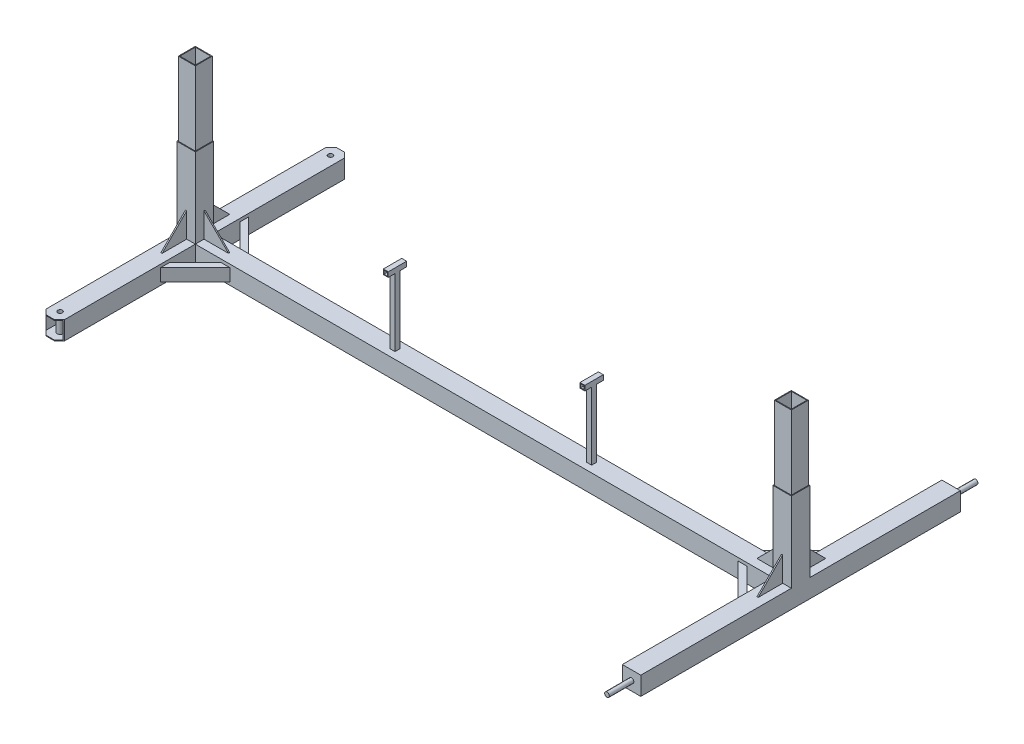
from build123d import *

# Parameters (mm, degrees)
SKETCH24_W           = 2500
SKETCH24_H           = 75
BOSS_EXTRUDE19_DEPTH = 75
SKETCH25_W           = 75
SKETCH25_H           = 75
BOSS_EXTRUDE21_DEPTH = 325
SKETCH27_W           = 69
SKETCH27_H           = 69
BOSS_EXTRUDE22_DEPTH = 300
SKETCH36_W           = 20
SKETCH36_H           = 20
BOSS_EXTRUDE29_DEPTH = 275
SKETCH37_W           = 20
SKETCH37_H           = 20
BOSS_EXTRUDE30_DEPTH = 37.5
SKETCH44_W           = 75
SKETCH44_H           = 75
BOSS_EXTRUDE35_DEPTH = 590
SKETCH46_W           = 75
SKETCH46_H           = 75
BOSS_EXTRUDE36_DEPTH = 650
BOSS_EXTRUDE37_DEPTH = 25
GUSSET1_THICKNESS    = 5
GUSSET2_THICKNESS    = 5
GUSSET3_THICKNESS    = 5
GUSSET4_THICKNESS    = 5
GUSSET5_THICKNESS    = 5
GUSSET6_THICKNESS    = 5
SHELL7_T             = -3
SKETCH54_R           = 12.5
BOSS_EXTRUDE38_DEPTH = 75
SKETCH55_R           = 9.5
CUT_EXTRUDE1_DEPTH   = 1542.30626418
CHAMFER1_SIZE        = 20
BOSS_EXTRUDE39_DEPTH = 6
SKETCH57_R           = 9.5
BOSS_EXTRUDE40_DEPTH = 30
SKETCH59_W           = 75
SKETCH59_H           = 75
BOSS_EXTRUDE41_DEPTH = 8
SKETCH60_R           = 9.5
BOSS_EXTRUDE42_DEPTH = 100


with BuildPart() as part:
    # Sketch24 → Boss-Extrude19 (new body)
    with BuildSketch(Plane(origin=(0, 0, 0), x_dir=(1, 0, 0), z_dir=(0, 1, 0))):
        Rectangle(SKETCH24_W, SKETCH24_H)
    extrude(amount=BOSS_EXTRUDE19_DEPTH)

    # Sketch25 → Boss-Extrude21 (add)
    with BuildSketch(Plane(origin=(0, 75, 0), x_dir=(1, 0, 0), z_dir=(0, 1, 0))):
        with Locations((-1212.5, 0)):
            Rectangle(SKETCH25_W, SKETCH25_H)
        with Locations((1212.5, 0)):
            Rectangle(SKETCH25_W, SKETCH25_H)
    extrude(amount=BOSS_EXTRUDE21_DEPTH)

    # Sketch27 → Boss-Extrude22 (add)
    with BuildSketch(Plane(origin=(0, 400, 0), x_dir=(1, 0, 0), z_dir=(0, 1, 0))):
        with Locations((-1212.5, 0)):
            Rectangle(SKETCH27_W, SKETCH27_H)
        with Locations((1212.5, 0)):
            Rectangle(SKETCH27_W, SKETCH27_H)
    extrude(amount=BOSS_EXTRUDE22_DEPTH)

    # Sketch36 → Boss-Extrude29 (add)
    with BuildSketch(Plane(origin=(0, 75, 0), x_dir=(1, 0, 0), z_dir=(0, 1, 0))):
        with Locations((-400, 0)):
            Rectangle(SKETCH36_W, SKETCH36_H)
    boss_extrude29 = extrude(amount=BOSS_EXTRUDE29_DEPTH)

    # Sketch37 → Boss-Extrude30 (add, symmetric)
    with BuildSketch(Plane.XY):
        with Locations((-400, 360)):
            Rectangle(SKETCH37_W, SKETCH37_H)
    boss_extrude30 = extrude(amount=BOSS_EXTRUDE30_DEPTH, both=True)

    # Sketch44 → Boss-Extrude35 (add, symmetric)
    with BuildSketch(Plane.XY):
        with Locations((-1212.5, 37.5)):
            Rectangle(SKETCH44_W, SKETCH44_H)
    extrude(amount=BOSS_EXTRUDE35_DEPTH, both=True)

    # Sketch46 → Boss-Extrude36 (add, symmetric)
    with BuildSketch(Plane.XY):
        with Locations((1212.5, 37.5)):
            Rectangle(SKETCH46_W, SKETCH46_H)
    extrude(amount=BOSS_EXTRUDE36_DEPTH, both=True)

    # Sketch47 → Boss-Extrude37 (add, symmetric)
    with BuildSketch(Plane(origin=(0, 37.5, 0), x_dir=(1, 0, 0), z_dir=(0, 1, 0))):
        Polygon((-1175, 178.921356237), (-1175, 143.566017178), (-1068.933982822, 37.5), (-1033.578643763, 37.5), align=None)
        Polygon((-1175, -143.566017178), (-1068.933982822, -37.5), (-1033.578643763, -37.5), (-1175, -178.921356237), align=None)
    boss_extrude37 = extrude(amount=BOSS_EXTRUDE37_DEPTH, both=True)

    # Mirror4: Boss-Extrude37 across plane
    add(boss_extrude37.mirror(Plane(origin=(0, 0, 0), x_dir=(0, 0, 1), z_dir=(1, 0, 0))))

    # Mirror5: Boss-Extrude29, Boss-Extrude30 across plane
    add(boss_extrude29.mirror(Plane(origin=(0, 0, 0), x_dir=(0, 0, 1), z_dir=(1, 0, 0))))
    add(boss_extrude30.mirror(Plane(origin=(0, 0, 0), x_dir=(0, 0, 1), z_dir=(1, 0, 0))))

    # Shell7
    shell7_openings = [part.faces().sort_by_distance(p)[0] for p in [
        (-1212.5, 37.5, 590),
        (-1212.5, 37.5, -590),
        (1212.5, 37.5, 650),
        (1212.5, 37.5, -650),
        (400, 360, 37.5),
        (400, 360, -37.5),
        (1212.5, 700, 0),
        (-1212.5, 700, 0),
        (-400, 360, 37.5),
        (-400, 360, -37.5),
    ]]
    offset(amount=SHELL7_T, openings=shell7_openings, kind=Kind.INTERSECTION)

    # Sketch54 → Boss-Extrude38 (add)
    with BuildSketch(Plane(origin=(0, 75, 0), x_dir=(1, 0, 0), z_dir=(0, 1, 0))):
        with Locations(Location((-1212.5, 550, 0), (0, 0, 90))):
            Circle(SKETCH54_R)
        with Locations(Location((-1212.5, -550, 0), (0, 0, 90))):
            Circle(SKETCH54_R)
    extrude(amount=-BOSS_EXTRUDE38_DEPTH)

    # Sketch55 → Cut-Extrude1 (cut, through all)
    with BuildSketch(Plane(origin=(0, 75, 0), x_dir=(1, 0, 0), z_dir=(0, 1, 0))):
        with Locations(Location((-1212.5, 550, 0), (0, 0, 270))):
            Circle(SKETCH55_R)
        with Locations(Location((-1212.5, -550, 0), (0, 0, 270))):
            Circle(SKETCH55_R)
    extrude(amount=-CUT_EXTRUDE1_DEPTH, mode=Mode.SUBTRACT)

    # Chamfer1
    # the kernel refuses this chamfer: 20 mm, written as the material it takes off along each edge
    with BuildSketch(Plane(origin=(-1250, 126.433659759, -590), x_dir=(-0.02749587661058214, 0, 0.9996219169112969), z_dir=(0, -1, 0)), Plane(origin=(-1175, -51.433659759, -590), x_dir=(0.02749587661058214, 0, 0.9996219169112969), z_dir=(0, 1, 0))) as chamfer1_piece_1:
        Polygon((CHAMFER1_SIZE * 0.999621916911, -CHAMFER1_SIZE * 0.0274958766106), (-CHAMFER1_SIZE * 0.0274958766106, -CHAMFER1_SIZE * 0.999621916911), (0, 0), align=None)
    extrude(amount=177.867319519, mode=Mode.SUBTRACT)
    with BuildSketch(Plane(origin=(-1250, 126.433659759, 590), x_dir=(-0.02749587661058214, 0, -0.9996219169112969), z_dir=(0, -1, 0)), Plane(origin=(-1175, -51.433659759, 590), x_dir=(0.02749587661058214, 0, -0.9996219169112969), z_dir=(0, 1, 0))) as chamfer1_piece_2:
        Polygon((CHAMFER1_SIZE * 0.999621916911, CHAMFER1_SIZE * 0.0274958766106), (-CHAMFER1_SIZE * 0.0274958766106, CHAMFER1_SIZE * 0.999621916911), (0, 0), align=None)
    extrude(amount=177.867319519, mode=Mode.SUBTRACT)

    # Sketch59 → Boss-Extrude41 (add)
    with BuildSketch(Plane.XY.offset(650)):
        with Locations((1212.5, 37.5)):
            Rectangle(SKETCH59_W, SKETCH59_H)
    boss_extrude41 = extrude(amount=-BOSS_EXTRUDE41_DEPTH)

    # Sketch60 → Boss-Extrude42 (add)
    with BuildSketch(Plane.XY.offset(650)):
        with Locations((1212.5, 37.5)):
            Circle(SKETCH60_R)
    boss_extrude42 = extrude(amount=BOSS_EXTRUDE42_DEPTH)

    # Mirror9: Boss-Extrude41, Boss-Extrude42 across plane
    add(boss_extrude41.mirror(Plane.XY))
    add(boss_extrude42.mirror(Plane.XY))


with BuildPart() as body_2:
    # Gusset1: a gusset: a plate 5.0 thick in the corner of two members, its outline drawn in place
    gusset1_outline = Wire([Line((-1215, 75, 37.5), (-1215, 75, 137.5)), Line((-1215, 75, 137.5), (-1215, 175, 37.5)), Line((-1215, 175, 37.5), (-1215, 75, 37.5))])
    add(extrude(Face(gusset1_outline), amount=GUSSET1_THICKNESS, dir=(1, 0, 0)))


with BuildPart() as body_3:
    # Gusset2: a gusset: a plate 5.0 thick in the corner of two members, its outline drawn in place
    gusset2_outline = Wire([Line((-1175, 75, -2.5), (-1175, 175, -2.5)), Line((-1175, 175, -2.5), (-1075, 75, -2.5)), Line((-1075, 75, -2.5), (-1175, 75, -2.5))])
    add(extrude(Face(gusset2_outline), amount=GUSSET2_THICKNESS, dir=(0, 0, 1)))


with BuildPart() as body_4:
    # Gusset3: a gusset: a plate 5.0 thick in the corner of two members, its outline drawn in place
    gusset3_outline = Wire([Line((-1215, 75, -37.5), (-1215, 175, -37.5)), Line((-1215, 175, -37.5), (-1215, 75, -137.5)), Line((-1215, 75, -137.5), (-1215, 75, -37.5))])
    add(extrude(Face(gusset3_outline), amount=GUSSET3_THICKNESS, dir=(1, 0, 0)))


with BuildPart() as body_5:
    # Gusset4: a gusset: a plate 5.0 thick in the corner of two members, its outline drawn in place
    gusset4_outline = Wire([Line((1215, 75, -37.5), (1215, 75, -137.5)), Line((1215, 75, -137.5), (1215, 175, -37.5)), Line((1215, 175, -37.5), (1215, 75, -37.5))])
    add(extrude(Face(gusset4_outline), amount=GUSSET4_THICKNESS, dir=(-1, 0, 0)))


with BuildPart() as body_6:
    # Gusset5: a gusset: a plate 5.0 thick in the corner of two members, its outline drawn in place
    gusset5_outline = Wire([Line((1210, 75, 37.5), (1210, 75, 137.5)), Line((1210, 75, 137.5), (1210, 175, 37.5)), Line((1210, 175, 37.5), (1210, 75, 37.5))])
    add(extrude(Face(gusset5_outline), amount=GUSSET5_THICKNESS, dir=(1, 0, 0)))


with BuildPart() as body_7:
    # Gusset6: a gusset: a plate 5.0 thick in the corner of two members, its outline drawn in place
    gusset6_outline = Wire([Line((1175, 75, -2.5), (1075, 75, -2.5)), Line((1075, 75, -2.5), (1175, 175, -2.5)), Line((1175, 175, -2.5), (1175, 75, -2.5))])
    add(extrude(Face(gusset6_outline), amount=GUSSET6_THICKNESS, dir=(0, 0, 1)))


with BuildPart() as body_8:
    # Sketch56 → Boss-Extrude39 (new body)
    with BuildSketch(Plane.XZ):
        Polygon((-1250, 50), (-1175, 50), (-1150, 37.5), (-1150, -37.5), (-1175, -50), (-1250, -50), align=None)
    extrude(amount=BOSS_EXTRUDE39_DEPTH)


with BuildPart() as body_9:
    # Sketch57 → Boss-Extrude40 (new body)
    with BuildSketch(Plane.XZ.offset(6)):
        with Locations(Location((-1212.5, 0, 0), (0, 0, 270))):
            Circle(SKETCH57_R)
    extrude(amount=BOSS_EXTRUDE40_DEPTH)


solid = Compound([part.part, body_2.part, body_3.part, body_4.part, body_5.part, body_6.part, body_7.part, body_8.part, body_9.part])
